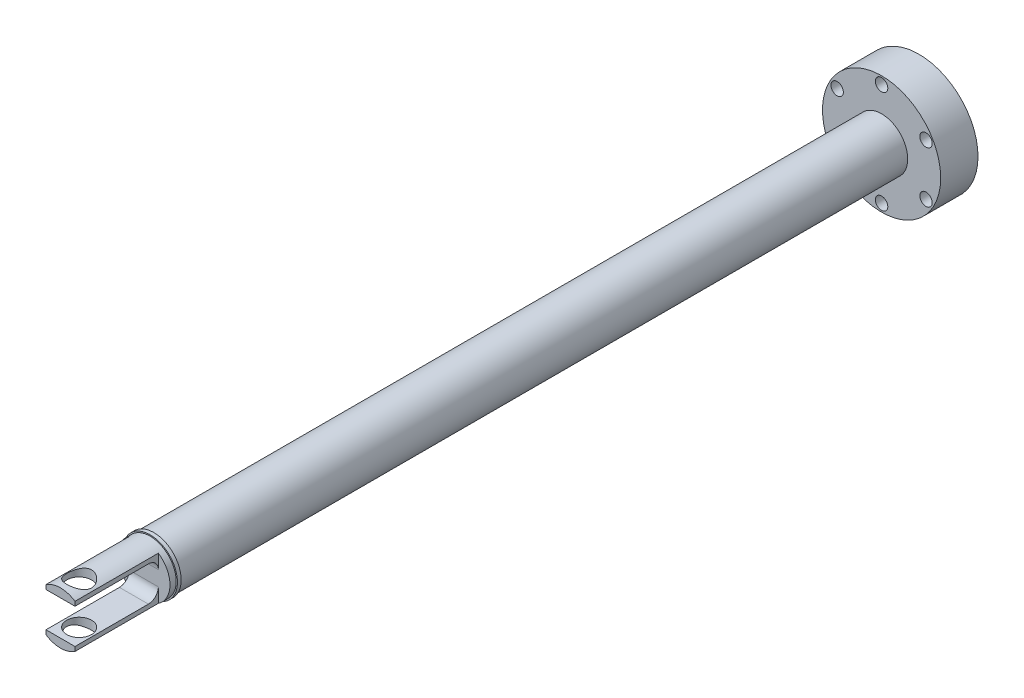
from build123d import *

# Parameters (mm, degrees)
SZKIC1_R                               = 47.5
DODANIE_WYCI_GNI_CIE1_DEPTH            = 30
WYTNIJ_WYCI_GNI_CIE1_REACH             = 75.57
SZKIC2_R                               = 5
SZYK_KO_OWY1_COUNT                     = 6
SZKIC3_R                               = 21
DODANIE_WYCI_GNI_CIE2_DEPTH            = 585
DODANIE_WYCI_GNI_CIE3_DEPTH            = 75
SZKIC5_R                               = 22
DODANIE_WYCI_GNI_CIE4_DEPTH            = 3
SZKIC7_R                               = 21
DODANIE_WYCI_GNI_CIE5_DEPTH            = 5
WYTNIJ_WYCI_GNI_CIE2_REACH             = 696.362
SZKIC8_R                               = 10
WYTNIJ_WYCI_GNI_CIE2_DIRECTION_2_DEPTH = 695.361937321
WYTNIJ_WYCI_GNI_CIE3_START             = -67
WYTNIJ_WYCI_GNI_CIE3_DEPTH             = 67
ZAOKR_GLENIE1_R                        = 8


with BuildPart() as part:
    # Szkic1 → Dodanie-wyciągnięcie1 (new body)
    with BuildSketch(Plane.XY):
        Circle(SZKIC1_R)
    extrude(amount=DODANIE_WYCI_GNI_CIE1_DEPTH)

    # Szkic2 → Wytnij-wyciągnięcie1 (cut, up to next)
    with BuildSketch(Plane.XY.offset(30), mode=Mode.PRIVATE) as wytnij_wyci_gni_cie1_sk1:
        with Locations((0, 41.25)):
            Circle(SZKIC2_R)
    wytnij_wyci_gni_cie1_tool1 = extrude(wytnij_wyci_gni_cie1_sk1.sketch, amount=-WYTNIJ_WYCI_GNI_CIE1_REACH, mode=Mode.PRIVATE) & part.part
    wytnij_wyci_gni_cie1 = wytnij_wyci_gni_cie1_tool1.solids().sort_by_distance((0, 41.25, 30))[0]
    add(wytnij_wyci_gni_cie1, mode=Mode.SUBTRACT)

    # Szyk kołowy1: Wytnij-wyciągnięcie1 ×6 about axis
    szyk_ko_owy1_axis = Axis((0, 0, 0), (0, 0, 1))
    for i in range(1, SZYK_KO_OWY1_COUNT):
        add(wytnij_wyci_gni_cie1.rotate(szyk_ko_owy1_axis, i * 360 / SZYK_KO_OWY1_COUNT), mode=Mode.SUBTRACT)

    # Szkic3 → Dodanie-wyciągnięcie2 (add)
    with BuildSketch(Plane.XY.offset(30)):
        Circle(SZKIC3_R)
    extrude(amount=DODANIE_WYCI_GNI_CIE2_DEPTH)

    # Szkic4 → Dodanie-wyciągnięcie3 (add)
    with BuildSketch(Plane.XY.offset(615)):
        with BuildLine():
            Line((-15.652475842, 14), (15.652475842, 14))
            ThreePointArc((15.652475842, 14), (0, 21), (-15.652475842, 14))
        make_face()
        with BuildLine():
            Line((-15.652475842, -14), (15.652475842, -14))
            ThreePointArc((15.652475842, -14), (0, -21), (-15.652475842, -14))
        make_face()
    extrude(amount=DODANIE_WYCI_GNI_CIE3_DEPTH)

    # Szkic5 → Dodanie-wyciągnięcie4 (add)
    with BuildSketch(Plane.XY.offset(615)):
        Circle(SZKIC5_R)
    extrude(amount=DODANIE_WYCI_GNI_CIE4_DEPTH)

    # Szkic7 → Dodanie-wyciągnięcie5 (add)
    with BuildSketch(Plane.XY.offset(618)):
        Circle(SZKIC7_R)
    extrude(amount=DODANIE_WYCI_GNI_CIE5_DEPTH)

    # Szkic8 → Wytnij-wyciągnięcie2 (cut, up to next)
    with BuildSketch(Plane(origin=(0, -14, 0), x_dir=(1, 0, 0), z_dir=(0, 1, 0)), mode=Mode.PRIVATE) as wytnij_wyci_gni_cie2_sk1:
        with Locations(Location((0, -675, 0), (0, 0, 90))):
            Circle(SZKIC8_R)
    wytnij_wyci_gni_cie2_tool1 = extrude(wytnij_wyci_gni_cie2_sk1.sketch, amount=-WYTNIJ_WYCI_GNI_CIE2_REACH, mode=Mode.PRIVATE) & part.part
    add(wytnij_wyci_gni_cie2_tool1.solids().sort_by_distance((0, -14, 675))[0], mode=Mode.SUBTRACT)

    # Szkic8 → Wytnij-wyciągnięcie2 direction 2 (cut)
    with BuildSketch(Plane(origin=(0, -14, 0), x_dir=(1, 0, 0), z_dir=(0, 1, 0))):
        with Locations(Location((0, -675, 0), (0, 0, 90))):
            Circle(SZKIC8_R)
    extrude(amount=WYTNIJ_WYCI_GNI_CIE2_DIRECTION_2_DEPTH, mode=Mode.SUBTRACT)

    # Szkic9 → Wytnij-wyciągnięcie3 (cut)
    with BuildSketch(Plane.XY.offset(690).offset(WYTNIJ_WYCI_GNI_CIE3_START)):
        with BuildLine():
            Line((-11.652475842, 14), (-11.652475842, 17.470541112))
            ThreePointArc((-11.652475842, 17.470541112), (-13.762313052, 15.861864312), (-15.652475842, 14))
            Line((-15.652475842, 14), (-11.652475842, 14))
        make_face()
        with BuildLine():
            Line((15.652475842, 14), (11.652475842, 14))
            Line((11.652475842, 14), (11.652475842, 17.470541112))
            ThreePointArc((11.652475842, 17.470541112), (13.762313052, 15.861864312), (15.652475842, 14))
        make_face()
        with BuildLine():
            Line((11.652475842, -14), (11.652475842, -17.470541112))
            ThreePointArc((11.652475842, -17.470541112), (13.762313052, -15.861864312), (15.652475842, -14))
            Line((15.652475842, -14), (11.652475842, -14))
        make_face()
        with BuildLine():
            Line((-15.652475842, -14), (-11.652475842, -14))
            Line((-11.652475842, -14), (-11.652475842, -17.470541112))
            ThreePointArc((-11.652475842, -17.470541112), (-13.762313052, -15.861864312), (-15.652475842, -14))
        make_face()
    extrude(amount=WYTNIJ_WYCI_GNI_CIE3_DEPTH, mode=Mode.SUBTRACT)

    # Zaokrąglenie1
    # the kernel refuses this fillet: 8 mm, written as the material it adds along each edge
    with BuildSketch(Plane(origin=(-11.652475842, -14, 623), x_dir=(0, 1, 0), z_dir=(1, 0, 0))) as zaokr_glenie1_piece_1:
        with BuildLine():
            CenterArc((ZAOKR_GLENIE1_R, ZAOKR_GLENIE1_R), ZAOKR_GLENIE1_R, 180, 90)
            Line((0, ZAOKR_GLENIE1_R), (0, 0))
            Line((0, 0), (ZAOKR_GLENIE1_R, 0))
        make_face()
    extrude(amount=23.304951685)
    with BuildSketch(Plane(origin=(-11.652475842, 14, 623), x_dir=(0, -1, 0), z_dir=(1, 0, 0))) as zaokr_glenie1_piece_2:
        with BuildLine():
            CenterArc((ZAOKR_GLENIE1_R, -ZAOKR_GLENIE1_R), ZAOKR_GLENIE1_R, 90, 90)
            Line((0, -ZAOKR_GLENIE1_R), (0, 0))
            Line((0, 0), (ZAOKR_GLENIE1_R, 0))
        make_face()
    extrude(amount=23.304951685)


solid = part.part
